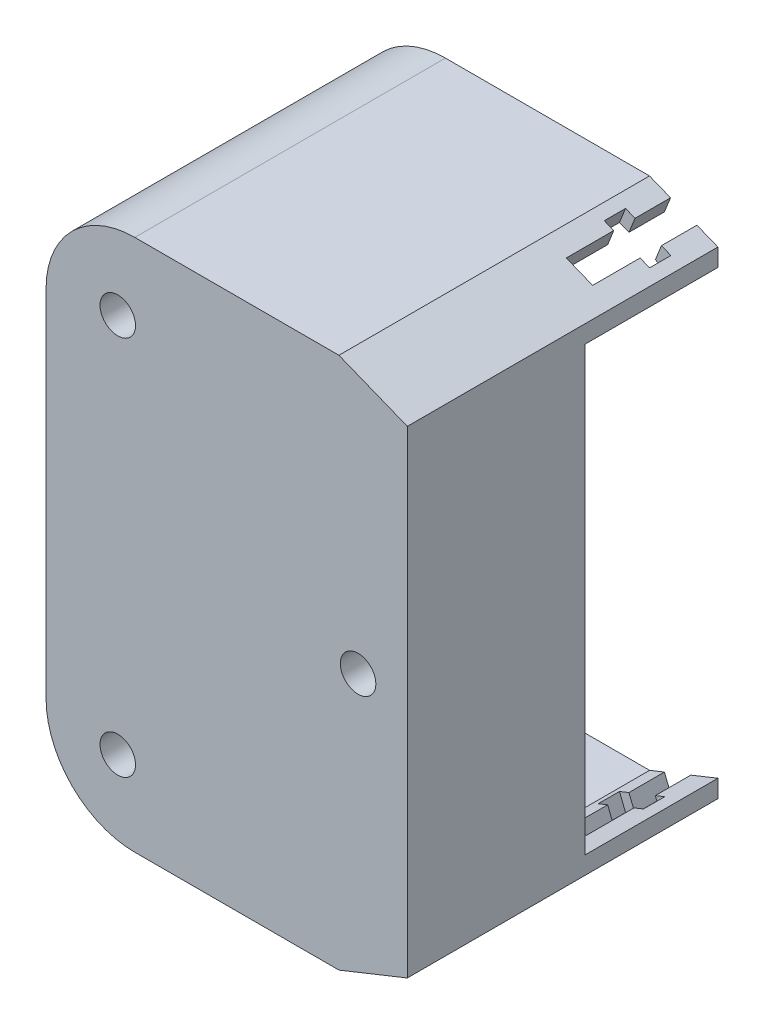
from build123d import *

# Parameters (mm, degrees)
BOSS_EXTRU_1_DEPTH            = 15
BOSS_EXTRU_2_START            = -3
BOSS_EXTRU_2_DEPTH            = 3
ENL_V_MAT_EXTRU_2_DEPTH       = 3
ENL_V_MAT_EXTRU_3_DEPTH       = 13
ESQUISSE8_R                   = 2
ENL_V_MAT_EXTRU_4_DEPTH       = 13
D_PLACER_START                = -20
D_PLACER_LA_FACE1_DEPTH       = 20
D_PLACER_START_2              = -12.248443577
D_PLACER_LA_FACE1_2_OUTLINE_W = 3.019195257
D_PLACER_LA_FACE1_2_OUTLINE_H = 5.492352827
D_PLACER_LA_FACE1_2_DEPTH     = 20
D_PLACER_LA_FACE1_3_OUTLINE_W = 3.019195257
D_PLACER_LA_FACE1_3_OUTLINE_H = 0.75
D_PLACER_LA_FACE1_3_DEPTH     = 4
D_PLACER_START_3              = -13.6
D_PLACER_LA_FACE1_4_OUTLINE_W = 3.019195257
D_PLACER_LA_FACE1_4_OUTLINE_H = 0.75
D_PLACER_LA_FACE1_4_DEPTH     = 1.351556423
D_PLACER_START_4              = -12.25
D_PLACER_LA_FACE1_5_OUTLINE_W = 3.019195257
D_PLACER_LA_FACE1_5_OUTLINE_H = 3.992352827
D_PLACER_LA_FACE1_5_DEPTH     = 0.001556423
ESQUISSE9_W                   = 4
ESQUISSE9_H                   = 4
ENL_V_MAT_EXTRU_5_DEPTH       = 10
ESQUISSE10_W                  = 4
ESQUISSE10_H                  = 4
ENL_V_MAT_EXTRU_6_DEPTH       = 10
ESQUISSE11_W                  = 4
ESQUISSE11_H                  = 3.962828904
ENL_V_MAT_EXTRU_7_DEPTH       = 10
ESQUISSE12_W                  = 0.4
ESQUISSE12_H                  = 5.351556423
ESQUISSE12_H_2                = 4
BOSS_EXTRU_4_DEPTH            = 1.853162708
ESQUISSE13_W                  = 0.4
ESQUISSE13_H                  = 5.351556423
ESQUISSE13_H_2                = 4
BOSS_EXTRU_5_DEPTH            = 1.853162708
ESQUISSE14_W                  = 5.349621474
ESQUISSE14_H                  = 0.4
ESQUISSE14_W_2                = 4
ESQUISSE14_W_3                = 5.35
BOSS_EXTRU_6_DEPTH            = 3.019195257
ESQUISSE16_W                  = 20
ESQUISSE16_H                  = 53.833895408
BOSS_EXTRU_7_DEPTH            = 1.75


# Read off the part's stored shape, not the designer's step: Déplacer la face1
with BuildPart() as part:
    # Esquisse2 → Boss.-Extru.1 (new body)
    with BuildSketch(Plane.XY):
        with BuildLine():
            Line((-33.300436576, 11.037686006), (-56.300436576, 11.037686006))
            ThreePointArc((-56.300436576, 11.037686006), (-63.371504388, 8.108753818), (-66.300436576, 1.037686006))
            Line((-66.300436576, 1.037686006), (-66.300436576, -38.962313994))
            ThreePointArc((-66.300436576, -38.962313994), (-63.371504388, -46.033381806), (-56.300436576, -48.962313994))
            Line((-56.300436576, -48.962313994), (-33.300436576, -48.962313994))
            Line((-33.300436576, -48.962313994), (-25.592805837, -45.879261698))
            Line((-25.592805837, -45.879261698), (-25.592805837, -43.883344379))
            Line((-25.592805837, -43.883344379), (-33.290229876, -46.962313994))
            Line((-33.290229876, -46.962313994), (-43.752587859, -46.962313994))
            Line((-43.752587859, -46.962313994), (-47.201202175, -46.962313994))
            Line((-47.201202175, -46.962313994), (-56.860485242, -46.962313994))
            ThreePointArc((-56.860485242, -46.962313994), (-61.412155775, -44.038827986), (-63.281241319, -38.962313994))
            Line((-63.281241319, -38.962313994), (-63.281241319, -24.376108696))
            Line((-63.281241319, -24.376108696), (-63.281241319, -13.548519292))
            Line((-63.281241319, -13.548519292), (-63.281241319, 1.037686006))
            ThreePointArc((-63.281241319, 1.037686006), (-61.412155775, 6.114199998), (-56.860485242, 9.037686006))
            Line((-56.860485242, 9.037686006), (-47.201202175, 9.037686006))
            Line((-47.201202175, 9.037686006), (-43.752587859, 9.037686006))
            Line((-43.752587859, 9.037686006), (-33.290229876, 9.037686006))
            Line((-33.290229876, 9.037686006), (-25.592805837, 5.958716391))
            Line((-25.592805837, 5.958716391), (-25.592805837, 7.95463371))
            Line((-25.592805837, 7.95463371), (-33.300436576, 11.037686006))
        make_face()
    extrude(amount=BOSS_EXTRU_1_DEPTH)

    # Esquisse4 → Boss.-Extru.2 (add)
    with BuildSketch(Plane.XY.offset(15).offset(BOSS_EXTRU_2_START)):
        with BuildLine():
            Line((-25.592805837, 5.958716391), (-33.290229876, 9.037686006))
            Line((-33.290229876, 9.037686006), (-56.860485242, 9.037686006))
            ThreePointArc((-56.860485242, 9.037686006), (-61.412155775, 6.114199998), (-63.281241319, 1.037686006))
            Line((-63.281241319, 1.037686006), (-63.281241319, -38.962313994))
            ThreePointArc((-63.281241319, -38.962313994), (-61.412155775, -44.038827986), (-56.860485242, -46.962313994))
            Line((-56.860485242, -46.962313994), (-33.290229876, -46.962313994))
            Line((-33.290229876, -46.962313994), (-25.592805837, -43.883344379))
            Line((-25.592805837, -43.883344379), (-25.592805837, 5.958716391))
        make_face()
    extrude(amount=BOSS_EXTRU_2_DEPTH)

    # Esquisse6 → Enlèv. mat.-Extru.2 (cut)
    with BuildSketch(Plane(origin=(-0.787065043, -1.967662607, 0), x_dir=(0.9284766908852589, -0.37139067635410505, 0), z_dir=(0.37139067635410505, 0.9284766908852589, 0))):
        Polygon((-32.867286648, 0), (-32.867286648, -4), (-33.617286648, -4), (-33.617286648, -6.4), (-32.867286648, -6.4), (-32.867286648, -7.751556423), (-28.867286648, -7.751556423), (-28.867286648, -6.4), (-28.117286648, -6.4), (-28.117286648, -4), (-28.867286648, -4), (-28.867286648, 0), align=None)
    enl_v_mat_extru_2 = extrude(amount=-ENL_V_MAT_EXTRU_2_DEPTH, mode=Mode.SUBTRACT)

    # Symétrie1: Enlèv. mat.-Extru.2 across plane
    add(enl_v_mat_extru_2.mirror(Plane(origin=(0, -18.962313994, 0), x_dir=(0, 0, 1), z_dir=(0, -1, 0))), mode=Mode.SUBTRACT)

    # Esquisse7 → Enlèv. mat.-Extru.3 (cut)
    with BuildSketch(Plane.ZY.offset(66.300436576)):
        Polygon((0, -20.962313994), (0, -16.969961167), (4, -16.969961167), (4, -16.219961167), (6.4, -16.219961167), (6.4, -16.969961167), (7.75, -16.969961167), (7.75, -20.962313994), (6.4, -20.962313994), (6.4, -21.712313994), (4, -21.712313994), (4, -20.962313994), align=None)
    extrude(amount=-ENL_V_MAT_EXTRU_3_DEPTH, mode=Mode.SUBTRACT)

    # Esquisse8 → Enlèv. mat.-Extru.4 (cut)
    with BuildSketch(Plane(origin=(0, 0, 12), x_dir=(-1, 0, 0), z_dir=(0, 0, -1))):
        with Locations((58.220840839, 2.471128854)):
            Circle(ESQUISSE8_R)
        with Locations(Location((58.220840839, -40.395756842, 0), (0, 0, 180))):
            Circle(ESQUISSE8_R)
        with Locations((31.142040455, -18.962313994)):
            Circle(ESQUISSE8_R)
    extrude(amount=-ENL_V_MAT_EXTRU_4_DEPTH, mode=Mode.SUBTRACT)

    # Déplacer la face1 outline → Déplacer la face1 (add)
    with BuildSketch(Plane.XY.offset(D_PLACER_START)):
        with BuildLine():
            Line((-32.688179458, -46.721493827), (-33.290229876, -46.962313994))
            Line((-33.290229876, -46.962313994), (-56.860485242, -46.962313994))
            ThreePointArc((-56.860485242, -46.962313994), (-61.412155775, -44.038827986), (-63.281241319, -38.962313994))
            Line((-63.281241319, -38.962313994), (-63.281241319, -21.712313994))
            Line((-63.281241319, -21.712313994), (-66.300436576, -21.712313994))
            Line((-66.300436576, -21.712313994), (-66.300436576, -38.962313994))
            ThreePointArc((-66.300436576, -38.962313994), (-63.371504388, -46.033381806), (-56.300436576, -48.962313994))
            Line((-56.300436576, -48.962313994), (-33.300436576, -48.962313994))
            Line((-33.300436576, -48.962313994), (-31.999932107, -48.442112206))
            Line((-31.999932107, -48.442112206), (-32.688179458, -46.721493827))
        make_face()
        Polygon((-25.592805837, -43.883344379), (-27.581557658, -44.678845107), (-26.893310307, -46.399463486), (-25.592805837, -45.879261698), align=None)
        Polygon((-27.581557658, 6.754217119), (-25.592805837, 5.958716391), (-25.592805837, 7.95463371), (-26.893310307, 8.474835498), align=None)
        with BuildLine():
            Line((-66.300436576, -16.219961167), (-63.281241319, -16.219961167))
            Line((-63.281241319, -16.219961167), (-63.281241319, 1.037686006))
            ThreePointArc((-63.281241319, 1.037686006), (-61.412155775, 6.114199998), (-56.860485242, 9.037686006))
            Line((-56.860485242, 9.037686006), (-33.290229876, 9.037686006))
            Line((-33.290229876, 9.037686006), (-32.688179458, 8.796865839))
            Line((-32.688179458, 8.796865839), (-31.999932107, 10.517484218))
            Line((-31.999932107, 10.517484218), (-33.300436576, 11.037686006))
            Line((-33.300436576, 11.037686006), (-56.300436576, 11.037686006))
            ThreePointArc((-56.300436576, 11.037686006), (-63.371504388, 8.108753818), (-66.300436576, 1.037686006))
            Line((-66.300436576, 1.037686006), (-66.300436576, -16.219961167))
        make_face()
    extrude(amount=D_PLACER_LA_FACE1_DEPTH)

    # D_placer la face1 2 outline → D_placer la face1 2 (add)
    with BuildSketch(Plane.XY.offset(D_PLACER_START_2)):
        Polygon((-32.688179458, -46.721493827), (-31.999932107, -48.442112206), (-26.893310307, -46.399463486), (-27.581557658, -44.678845107), align=None)
        with Locations((-64.790838948, -18.966137581)):
            Rectangle(D_PLACER_LA_FACE1_2_OUTLINE_W, D_PLACER_LA_FACE1_2_OUTLINE_H)
        Polygon((-27.581557658, 6.754217119), (-26.893310307, 8.474835498), (-31.999932107, 10.517484218), (-32.688179458, 8.796865839), align=None)
    extrude(amount=D_PLACER_LA_FACE1_2_DEPTH)

    # D_placer la face1 3 outline → D_placer la face1 3 (add)
    with BuildSketch(Plane.XY.offset(D_PLACER_START)):
        Polygon((-31.99182194, -46.44295082), (-32.688179458, -46.721493827), (-31.999932107, -48.442112206), (-31.303574589, -48.163569199), align=None)
        Polygon((-27.581557658, -44.678845107), (-28.277915177, -44.957388115), (-27.589667825, -46.678006494), (-26.893310307, -46.399463486), align=None)
        with Locations((-64.790838948, -21.337313994)):
            Rectangle(D_PLACER_LA_FACE1_3_OUTLINE_W, D_PLACER_LA_FACE1_3_OUTLINE_H)
        with Locations((-64.790838948, -16.594961167)):
            Rectangle(D_PLACER_LA_FACE1_3_OUTLINE_W, D_PLACER_LA_FACE1_3_OUTLINE_H)
        Polygon((-28.277915177, 7.032760127), (-27.581557658, 6.754217119), (-26.893310307, 8.474835498), (-27.589667825, 8.753378505), align=None)
        Polygon((-32.688179458, 8.796865839), (-31.99182194, 8.518322832), (-31.303574589, 10.238941211), (-31.999932107, 10.517484218), align=None)
    extrude(amount=D_PLACER_LA_FACE1_3_DEPTH)

    # D_placer la face1 4 outline → D_placer la face1 4 (add)
    with BuildSketch(Plane.XY.offset(D_PLACER_START_3)):
        Polygon((-31.99182194, -46.44295082), (-32.688179458, -46.721493827), (-31.999932107, -48.442112206), (-31.303574589, -48.163569199), align=None)
        Polygon((-27.581557658, -44.678845107), (-28.277915177, -44.957388115), (-27.589667825, -46.678006494), (-26.893310307, -46.399463486), align=None)
        with Locations((-64.790838948, -21.337313994)):
            Rectangle(D_PLACER_LA_FACE1_4_OUTLINE_W, D_PLACER_LA_FACE1_4_OUTLINE_H)
        with Locations((-64.790838948, -16.594961167)):
            Rectangle(D_PLACER_LA_FACE1_4_OUTLINE_W, D_PLACER_LA_FACE1_4_OUTLINE_H)
        Polygon((-28.277915177, 7.032760127), (-27.581557658, 6.754217119), (-26.893310307, 8.474835498), (-27.589667825, 8.753378505), align=None)
        Polygon((-32.688179458, 8.796865839), (-31.99182194, 8.518322832), (-31.303574589, 10.238941211), (-31.999932107, 10.517484218), align=None)
    extrude(amount=D_PLACER_LA_FACE1_4_DEPTH)

    # D_placer la face1 5 outline → D_placer la face1 5 (add)
    with BuildSketch(Plane.XY.offset(D_PLACER_START_4)):
        with Locations((-64.790838948, -18.966137581)):
            Rectangle(D_PLACER_LA_FACE1_5_OUTLINE_W, D_PLACER_LA_FACE1_5_OUTLINE_H)
    extrude(amount=D_PLACER_LA_FACE1_5_DEPTH)

    # Esquisse9 → Enlèv. mat.-Extru.5 (cut)
    with BuildSketch(Plane(origin=(12.290392884, -30.72598221, 0), x_dir=(0.928476690885259, 0.3713906763541048, 0), z_dir=(0.3713906763541047, -0.9284766908852589, 0))):
        with Locations((-44.952139887, -10.248443577)):
            Rectangle(ESQUISSE9_W, ESQUISSE9_H)
    extrude(amount=-ENL_V_MAT_EXTRU_5_DEPTH, mode=Mode.SUBTRACT)

    # Esquisse10 → Enlèv. mat.-Extru.6 (cut)
    with BuildSketch(Plane(origin=(-0.787065043, -1.967662607, 0), x_dir=(0.9284766908852589, -0.37139067635410505, 0), z_dir=(0.37139067635410505, 0.9284766908852589, 0))):
        with Locations((-30.867286648, 10.248443577)):
            Rectangle(ESQUISSE10_W, ESQUISSE10_H)
    extrude(amount=-ENL_V_MAT_EXTRU_6_DEPTH, mode=Mode.SUBTRACT)

    # Esquisse11 → Enlèv. mat.-Extru.7 (cut)
    with BuildSketch(Plane.ZY.offset(66.300436576)):
        with Locations((-10.25, -18.980899542)):
            Rectangle(ESQUISSE11_W, ESQUISSE11_H)
    extrude(amount=-ENL_V_MAT_EXTRU_7_DEPTH, mode=Mode.SUBTRACT)

    # Esquisse12 → Boss.-Extru.4 (add)
    with BuildSketch(Plane(origin=(-0.787065043, -1.967662607, 0), x_dir=(0.9284766908852589, -0.37139067635410505, 0), z_dir=(0.37139067635410505, 0.9284766908852589, 0))):
        with Locations((-32.667286648, 10.924221789)):
            Rectangle(ESQUISSE12_W, ESQUISSE12_H)
        with Locations((-32.667286648, 18)):
            Rectangle(ESQUISSE12_W, ESQUISSE12_H_2)
        with Locations((-29.067286648, 18)):
            Rectangle(ESQUISSE12_W, ESQUISSE12_H_2)
        with Locations((-29.067286648, 10.924221789)):
            Rectangle(ESQUISSE12_W, ESQUISSE12_H)
    extrude(amount=-BOSS_EXTRU_4_DEPTH)

    # Esquisse13 → Boss.-Extru.5 (add)
    with BuildSketch(Plane(origin=(12.290392884, -30.72598221, 0), x_dir=(0.928476690885259, 0.3713906763541048, 0), z_dir=(0.3713906763541047, -0.9284766908852589, 0))):
        with Locations((-43.152139887, -10.924221789)):
            Rectangle(ESQUISSE13_W, ESQUISSE13_H)
        with Locations((-46.752139887, -10.924221789)):
            Rectangle(ESQUISSE13_W, ESQUISSE13_H)
        with Locations((-46.752139887, -18)):
            Rectangle(ESQUISSE13_W, ESQUISSE13_H_2)
        with Locations((-43.152139887, -18)):
            Rectangle(ESQUISSE13_W, ESQUISSE13_H_2)
    extrude(amount=-BOSS_EXTRU_5_DEPTH)

    # Esquisse14 → Boss.-Extru.6 (add)
    with BuildSketch(Plane.ZY.offset(66.300436576)):
        with Locations((-10.924810737, -20.762313994)):
            Rectangle(ESQUISSE14_W, ESQUISSE14_H)
        with Locations((-18, -17.169961167)):
            Rectangle(ESQUISSE14_W_2, ESQUISSE14_H)
        with Locations((-18, -20.762313994)):
            Rectangle(ESQUISSE14_W_2, ESQUISSE14_H)
        with Locations((-10.925, -17.169961167)):
            Rectangle(ESQUISSE14_W_3, ESQUISSE14_H)
    extrude(amount=-BOSS_EXTRU_6_DEPTH)

    # Esquisse16 → Boss.-Extru.7 (add)
    with BuildSketch(Plane(origin=(-25.592805837, 0, 0), x_dir=(0, 0, -1), z_dir=(1, 0, 0))):
        with Locations((-5, -18.962313994)):
            Rectangle(ESQUISSE16_W, ESQUISSE16_H)
    extrude(amount=-BOSS_EXTRU_7_DEPTH)


solid = part.part
